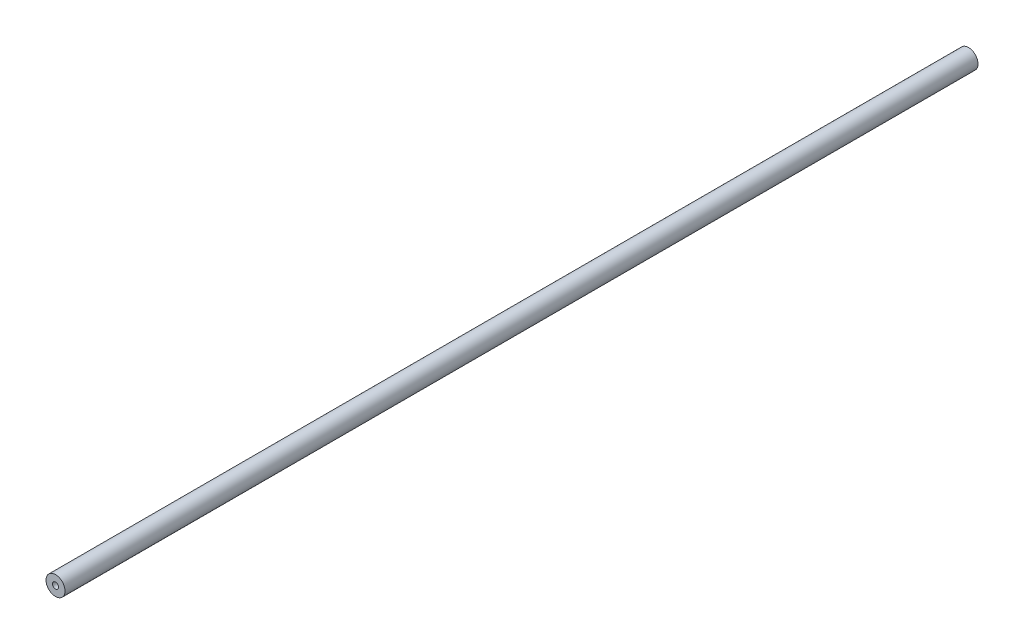
from build123d import *

# Parameters (mm, degrees)
SKETCH1_R                  = 6.35
BOSS_EXTRUDE1_DEPTH        = 609.6
F_10_32_TAPPED_HOLE1_D     = 4.0386
F_10_32_TAPPED_HOLE1_DEPTH = 13.716
F_10_32_TAPPED_HOLE1_TIP   = 1.213317848
F_10_32_TAPPED_HOLE2_D     = 4.0386
F_10_32_TAPPED_HOLE2_DEPTH = 13.716
F_10_32_TAPPED_HOLE2_TIP   = 1.213317848


with BuildPart() as part:
    # Sketch1 → Boss-Extrude1 (new body)
    with BuildSketch(Plane.XY):
        Circle(SKETCH1_R)
    extrude(amount=BOSS_EXTRUDE1_DEPTH)

    # #10-32 Tapped Hole1
    with Locations(Plane.XY.offset(609.6)):
        with Locations((0, 0)):
            Hole(F_10_32_TAPPED_HOLE1_D / 2, depth=F_10_32_TAPPED_HOLE1_DEPTH)
            with Locations((0, 0, -(F_10_32_TAPPED_HOLE1_DEPTH + F_10_32_TAPPED_HOLE1_TIP / 2))):  # 118° drill point
                Cone(0, F_10_32_TAPPED_HOLE1_D / 2, F_10_32_TAPPED_HOLE1_TIP, mode=Mode.SUBTRACT)

    # #10-32 Tapped Hole2
    with Locations(Plane(origin=(0, 0, 0), x_dir=(-1, 0, 0), z_dir=(0, 0, -1))):
        with Locations((0, 0)):
            Hole(F_10_32_TAPPED_HOLE2_D / 2, depth=F_10_32_TAPPED_HOLE2_DEPTH)
            with Locations((0, 0, -(F_10_32_TAPPED_HOLE2_DEPTH + F_10_32_TAPPED_HOLE2_TIP / 2))):  # 118° drill point
                Cone(0, F_10_32_TAPPED_HOLE2_D / 2, F_10_32_TAPPED_HOLE2_TIP, mode=Mode.SUBTRACT)


solid = part.part
